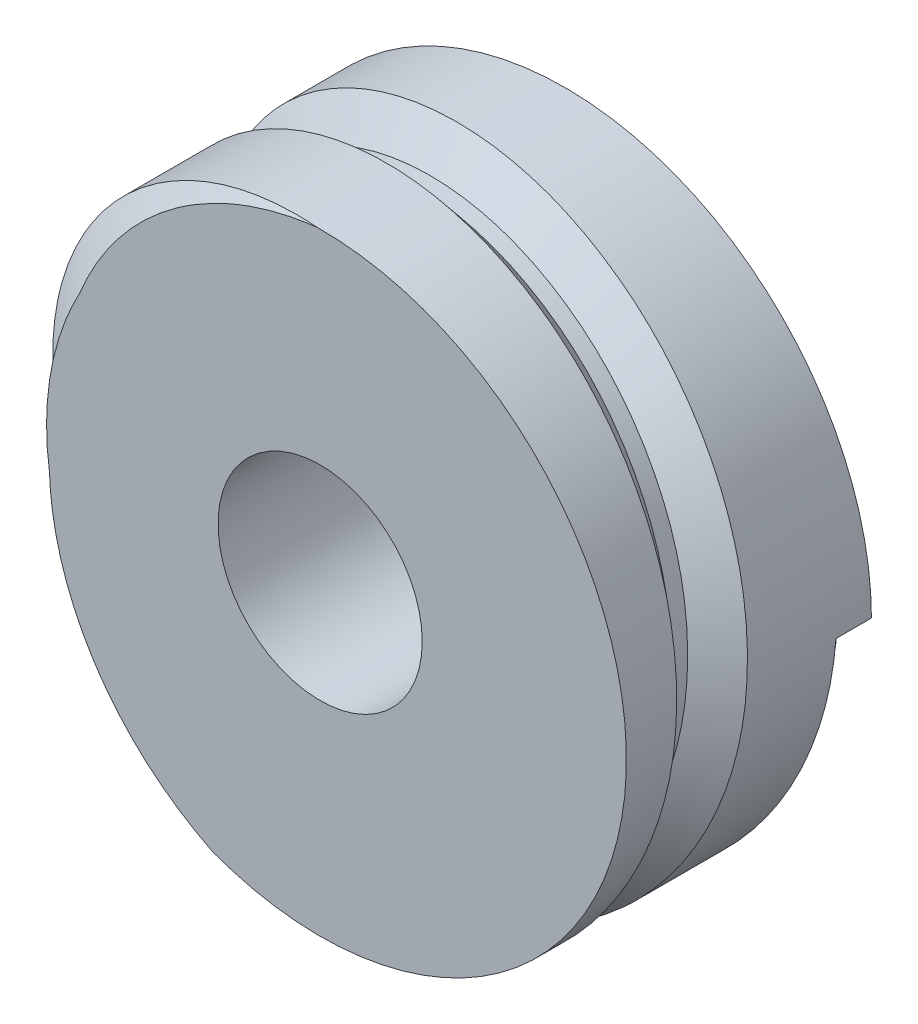
from build123d import *

# Parameters (mm, degrees)
SKETCH1_R           = 9.525
BOSS_EXTRUDE1_DEPTH = 7.62
SKETCH2_R           = 3.175
CUT_EXTRUDE1_DEPTH  = 16.476293161
CUT_SWEEP5_PITCH    = 4.98602


with BuildPart() as part:
    # Sketch1 → Boss-Extrude1 (new body)
    with BuildSketch(Plane.XY):
        with Locations(Location((0, 0, 0), (0, 0, 180))):
            Circle(SKETCH1_R)
    extrude(amount=BOSS_EXTRUDE1_DEPTH)

    # Sketch2 → Cut-Extrude1 (cut, through all)
    with BuildSketch(Plane.XY.offset(7.62)):
        Circle(SKETCH2_R)
    extrude(amount=-CUT_EXTRUDE1_DEPTH, mode=Mode.SUBTRACT)

    # Cut-Sweep5: arcs per turn and ends read off the stored shape
    # Cut-Sweep5: the profile of Sketch6 screwed along a left-hand helix through 2.5 turns, 12 arcs to a turn; built about Z, then put on its axis
    cut_sweep5_z = Axis((0, 0, 0), (0, 0, 1))
    cut_sweep5_corners = [(10.033, 2e-08, -1.522198128), (10.033, 2e-08, 1.525801872), (8.509, 1.7e-08, 0.255801872), (8.509, 1.7e-08, -0.252198128)]
    with BuildLine(mode=Mode.PRIVATE) as cut_sweep5_profile:
        Line(cut_sweep5_corners[0], cut_sweep5_corners[1])
        Line(cut_sweep5_corners[1], cut_sweep5_corners[2])
        Line(cut_sweep5_corners[2], cut_sweep5_corners[3])
        Line(cut_sweep5_corners[3], cut_sweep5_corners[0])
    cut_sweep5_cap = Face(cut_sweep5_profile.wire())
    cut_sweep5_turn_angles = [0, -15, -30, -45, -60, -75, -90, -105, -120, -135, -150, -165, -180, -195, -210, -225, -240, -255, -270, -285, -300, -315, -330, -345, -360]
    cut_sweep5_turn_weights = [1, 0.9659258262890683, 1, 0.9659258262890683, 1, 0.9659258262890683, 1, 0.9659258262890683, 1, 0.9659258262890683, 1, 0.9659258262890683, 1, 0.9659258262890683, 1, 0.9659258262890683, 1, 0.9659258262890683, 1, 0.9659258262890683, 1, 0.9659258262890683, 1, 0.9659258262890683, 1]
    cut_sweep5_turn_rails = [Edge.make_bspline([Vector(p[0], p[1], 0).rotate(cut_sweep5_z, cut_sweep5_turn_angles[k]) / cut_sweep5_turn_weights[k] + Vector(0, 0, p[2] + -CUT_SWEEP5_PITCH * cut_sweep5_turn_angles[k] / 360) for k in range(25)], [0, 0, 0, 1, 1, 2, 2, 3, 3, 4, 4, 5, 5, 6, 6, 7, 7, 8, 8, 9, 9, 10, 10, 11, 11, 12, 12, 12], 2, cut_sweep5_turn_weights) for p in cut_sweep5_corners]
    cut_sweep5_turn_sides = [Face.make_surface_from_curves(cut_sweep5_turn_rails[p[0]], cut_sweep5_turn_rails[p[1]]) for p in [(0, 1), (1, 2), (2, 3), (3, 0)]]
    cut_sweep5_last_angles = [-720, -735, -750, -765, -780, -795, -810, -825, -840, -855, -870, -885, -900]
    cut_sweep5_last_weights = [1, 0.9659258262890683, 1, 0.9659258262890683, 1, 0.9659258262890683, 1, 0.9659258262890683, 1, 0.9659258262890683, 1, 0.9659258262890683, 1]
    cut_sweep5_last_rails = [Edge.make_bspline([Vector(p[0], p[1], 0).rotate(cut_sweep5_z, cut_sweep5_last_angles[k]) / cut_sweep5_last_weights[k] + Vector(0, 0, p[2] + -CUT_SWEEP5_PITCH * cut_sweep5_last_angles[k] / 360) for k in range(13)], [0, 0, 0, 1, 1, 2, 2, 3, 3, 4, 4, 5, 5, 6, 6, 6], 2, cut_sweep5_last_weights) for p in cut_sweep5_corners]
    cut_sweep5_last_sides = [Face.make_surface_from_curves(cut_sweep5_last_rails[p[0]], cut_sweep5_last_rails[p[1]]) for p in [(0, 1), (1, 2), (2, 3), (3, 0)]]
    cut_sweep5 = Plane(origin=(0, 0, 0), x_dir=(1, 0, 0), z_dir=(0, 0, 1)) * Solid(Shell([*[p.moved(Location((0, 0, CUT_SWEEP5_PITCH * i))) for i in range(2) for p in cut_sweep5_turn_sides], *cut_sweep5_last_sides, cut_sweep5_cap, cut_sweep5_cap.rotate(cut_sweep5_z, -900).moved(Location((0, 0, -CUT_SWEEP5_PITCH * -900 / 360)))]))
    add(cut_sweep5, mode=Mode.SUBTRACT)


solid = part.part
